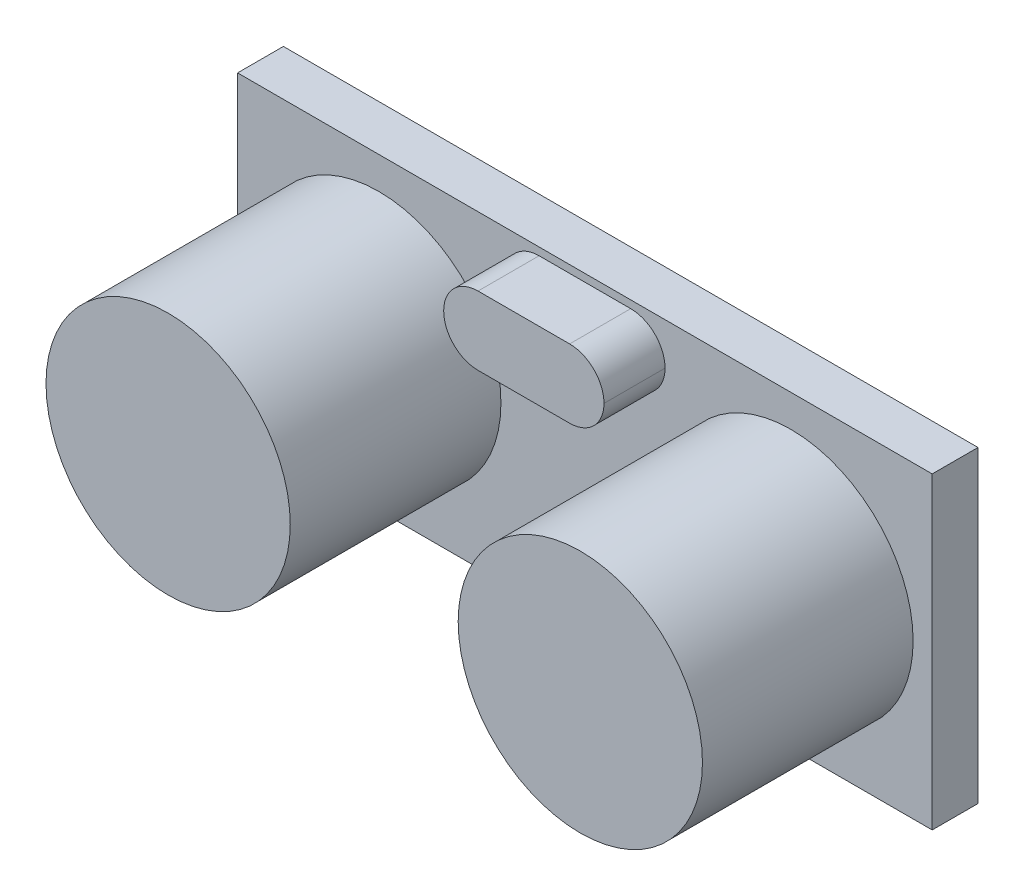
from build123d import *

# Parameters (mm, degrees)
SKETCH1_W                = 45.5
SKETCH1_H                = 20.2
BOSS_EXTRUDE1_DEPTH      = 3
SKETCH2_R                = 8
BOSS_EXTRUDE2_DEPTH      = 13.8
SKETCH3_W                = 10.5
SKETCH3_H                = 4.5
BOSS_EXTRUDE3_DEPTH      = 4
FILLET1_R                = 2.25
BOSS_EXTRUDE4_DEPTH      = 10
BOSS_EXTRUDE4_DEPTH_BACK = 5
SKETCH4_W                = 10.16
SKETCH4_H                = 2.54


with BuildPart() as part:
    # Sketch1 → Boss-Extrude1 (new body)
    with BuildSketch(Plane.XY):
        Rectangle(SKETCH1_W, SKETCH1_H)
    extrude(amount=BOSS_EXTRUDE1_DEPTH)

    # Sketch2 → Boss-Extrude2 (add)
    with BuildSketch(Plane.XY.offset(3)):
        with Locations(Location((-13.5, 0, 0), (0, 0, 180))):
            Circle(SKETCH2_R)
        with Locations(Location((13.5, 0, 0), (0, 0, 180))):
            Circle(SKETCH2_R)
    extrude(amount=BOSS_EXTRUDE2_DEPTH)

    # Sketch3 → Boss-Extrude3 (add)
    with BuildSketch(Plane.XY.offset(3)):
        with Locations((0, 7.35)):
            Rectangle(SKETCH3_W, SKETCH3_H)
    extrude(amount=BOSS_EXTRUDE3_DEPTH)

    # Fillet1
    fillet1_edges = [part.edges().sort_by_distance(p)[0] for p in [
        (-5.25, 5.1, 5),
        (-5.25, 9.6, 5),
        (5.25, 5.1, 5),
        (5.25, 9.6, 5),
    ]]
    fillet(fillet1_edges, radius=FILLET1_R - 0.0001)  # a hair under: the kernel refuses the full size

    # Sketch4 → Boss-Extrude4 (add, two sides: drawn at the far end of the back side and taken through both)
    with BuildSketch(Plane(origin=(0, 0, 0), x_dir=(-1, 0, 0), z_dir=(0, 0, -1)).offset(-BOSS_EXTRUDE4_DEPTH_BACK)):
        with Locations((0, -8.83)):
            Rectangle(SKETCH4_W, SKETCH4_H)
    extrude(amount=BOSS_EXTRUDE4_DEPTH + BOSS_EXTRUDE4_DEPTH_BACK)


solid = part.part
